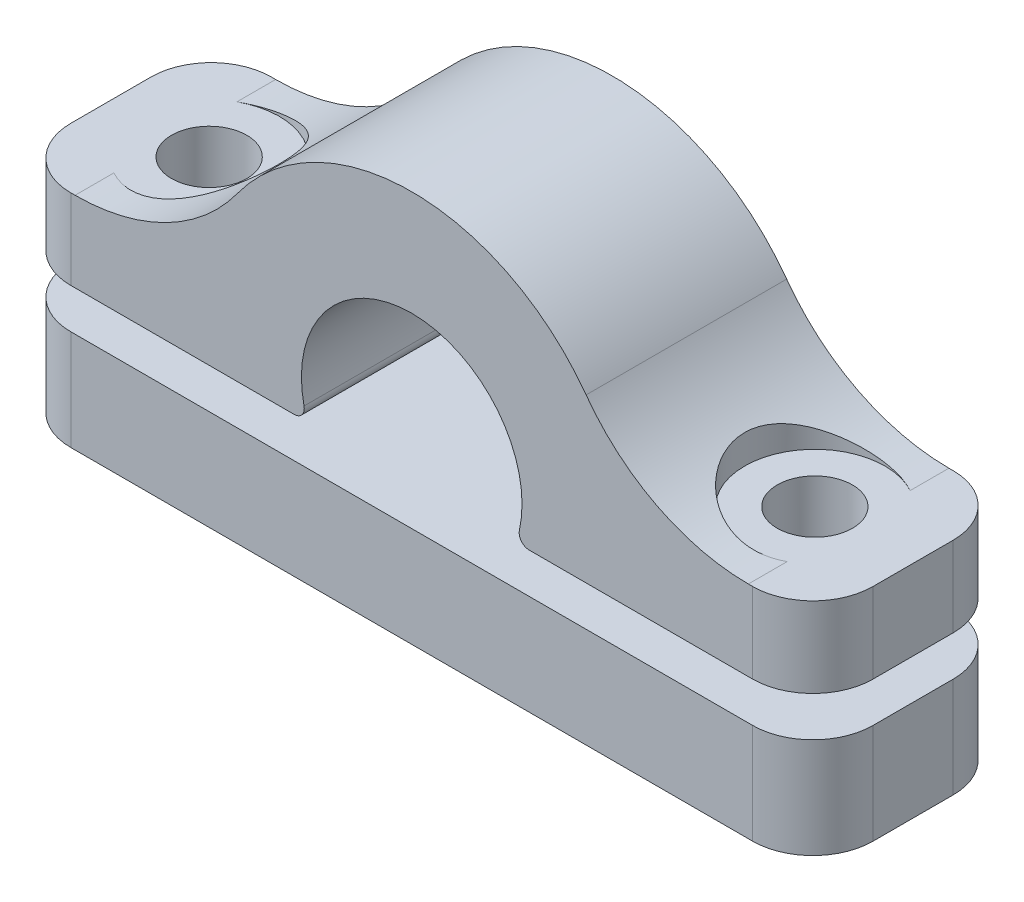
from build123d import *

# Parameters (mm, degrees)
BOSS_EXTRUDE1_START      = -1
SKETCH1_W                = 40
SKETCH1_H                = 10
BOSS_EXTRUDE1_DEPTH      = 5
BOSS_EXTRUDE2_DEPTH      = 5
BOSS_EXTRUDE2_DEPTH_BACK = 5
SKETCH3_W                = 10
SKETCH3_H                = 10
BOSS_EXTRUDE3_DEPTH      = 5
FILLET1_R                = 3
FILLET2_R                = 3
FILLET4_R                = 10
CUT_EXTRUDE1_DEPTH       = 25.669870287
CUT_EXTRUDE1_DEPTH_BACK  = 25.669870287
SKETCH4_R                = 1.875
CUT_EXTRUDE2_START       = 5
SKETCH5_R                = 3.5
CUT_EXTRUDE2_DEPTH       = 10
SKETCH9_W                = 47.094451366
SKETCH9_H                = 23.336565295
CUT_EXTRUDE5_DEPTH       = 1
FILLET5_R                = 0.5


with BuildPart() as part:
    # Sketch1 → Boss-Extrude1 (new body)
    with BuildSketch(Plane(origin=(0, 0, 0), x_dir=(1, 0, 0), z_dir=(0, 1, 0)).offset(BOSS_EXTRUDE1_START)):
        Rectangle(SKETCH1_W, SKETCH1_H)
    extrude(amount=-BOSS_EXTRUDE1_DEPTH)

    # Fillet2
    fillet2_edges = [part.edges().sort_by_distance(p)[0] for p in [
        (-20, -3.5, 5),
        (-20, -3.5, -5),
        (20, -3.5, 5),
        (20, -3.5, -5),
    ]]
    fillet(fillet2_edges, radius=FILLET2_R)


with BuildPart() as body_2:
    # Sketch2 → Boss-Extrude2 (new, two sides: drawn at the far end of the back side and taken through both)
    with BuildSketch(Plane.XY.offset(-BOSS_EXTRUDE2_DEPTH_BACK)):
        with BuildLine():
            Line((-10.378945033, 0), (-4.733920151, 0))
            ThreePointArc((-4.733920151, 0), (0, 8.3), (4.733920151, 0))
            Line((4.733920151, 0), (10.378945033, 0))
            ThreePointArc((10.378945033, 0), (0, 13.55), (-10.378945033, 0))
        make_face()
    extrude(amount=BOSS_EXTRUDE2_DEPTH + BOSS_EXTRUDE2_DEPTH_BACK)

    # Sketch3 → Boss-Extrude3 (add)
    with BuildSketch(Plane(origin=(0, 0, 0), x_dir=(1, 0, 0), z_dir=(0, 1, 0))):
        with Locations((-15, 0)):
            Rectangle(SKETCH3_W, SKETCH3_H)
        with Locations((15, 0)):
            Rectangle(SKETCH3_W, SKETCH3_H)
    extrude(amount=BOSS_EXTRUDE3_DEPTH)

    # Fillet1
    fillet1_edges = [body_2.edges().sort_by_distance(p)[0] for p in [
        (20, 2.5, -5),
        (20, 2.5, 5),
        (-20, 2.5, -5),
        (-20, 2.5, 5),
    ]]
    fillet(fillet1_edges, radius=FILLET1_R)

    # Fillet4
    fillet4_edges = [body_2.edges().sort_by_distance(p)[0] for p in [
        (10.522475944, 5, 0),
        (-10.522475944, 5, 0),
    ]]
    fillet(fillet4_edges, radius=FILLET4_R)


with BuildPart() as cut_extrude1_tool:
    # Sketch4 → Cut-Extrude1 (new, two sides: drawn at the far end of the back side and taken through both)
    with BuildSketch(Plane(origin=(0, 0, 0), x_dir=(1, 0, 0), z_dir=(0, 1, 0)).offset(-CUT_EXTRUDE1_DEPTH_BACK)):
        with Locations((-15.1, 0)):
            Circle(SKETCH4_R)
        with Locations((15.1, 0)):
            Circle(SKETCH4_R)
    extrude(amount=CUT_EXTRUDE1_DEPTH + CUT_EXTRUDE1_DEPTH_BACK)


with BuildPart() as part_1:
    add(part.part)

    # Cut-Extrude1: cut by cut_extrude1_tool
    add(cut_extrude1_tool.part, mode=Mode.SUBTRACT)


with BuildPart() as body_2_1:
    add(body_2.part)

    # Cut-Extrude1: cut by cut_extrude1_tool
    add(cut_extrude1_tool.part, mode=Mode.SUBTRACT)

    # Sketch5 → Cut-Extrude2 (cut)
    with BuildSketch(Plane(origin=(0, 0, 0), x_dir=(1, 0, 0), z_dir=(0, 1, 0)).offset(CUT_EXTRUDE2_START)):
        with Locations((-15.1, 0)):
            Circle(SKETCH5_R)
        with Locations((15.1, 0)):
            Circle(SKETCH5_R)
    extrude(amount=CUT_EXTRUDE2_DEPTH, mode=Mode.SUBTRACT)

    # Sketch9 → Cut-Extrude5 (cut)
    with BuildSketch(Plane(origin=(0, 0, 0), x_dir=(1, 0, 0), z_dir=(0, 1, 0))):
        with Locations((2.081495267, 0.004136026)):
            Rectangle(SKETCH9_W, SKETCH9_H)
    extrude(amount=CUT_EXTRUDE5_DEPTH, mode=Mode.SUBTRACT)

    # Fillet5
    fillet5_edges = [body_2_1.edges().sort_by_distance(p)[0] for p in [
        (-5.197114584, 1, 0),
        (5.197114584, 1, 0),
    ]]
    fillet(fillet5_edges, radius=FILLET5_R)


solid = Compound([part_1.part, body_2_1.part])
